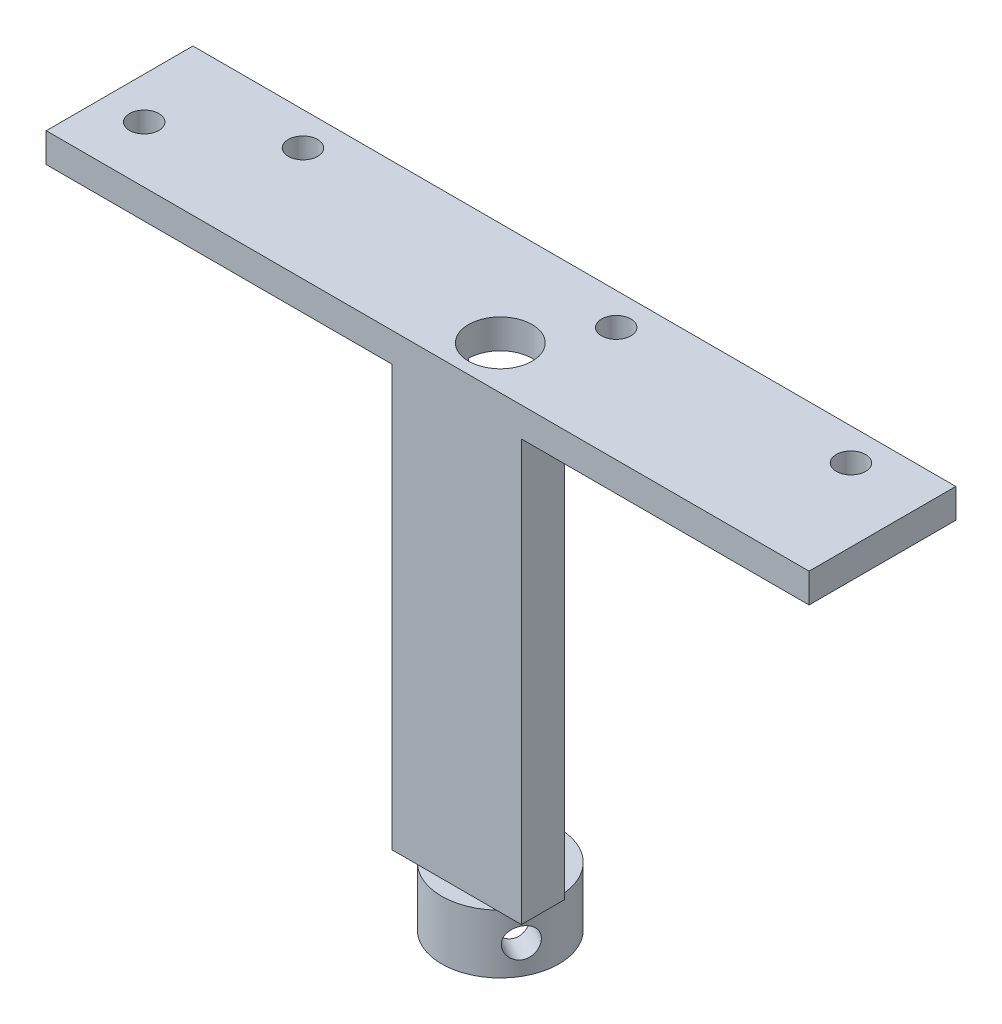
from build123d import *

# Parameters (mm, degrees)
SKETCH_1_W                = 78
SKETCH_1_H                = 15
EXTRUDE_1_DEPTH           = 3
SKETCH_3_R                = 1.5
CUT_EXTRUDE_1_DEPTH       = 3
SKETCH_4_R                = 6
EXTRUDE_2_DEPTH           = 18
SKETCH_5_R                = 4.5
CUT_EXTRUDE_2_DEPTH       = 21
F_2_0MM_2_D               = 3
F_2_0MM_2_DEPTH           = 4.5
F_2_0MM_2_TIP             = 1.5
F_2_0MM_2_ON_FACE_2_D     = 3
F_2_0MM_2_ON_FACE_2_DEPTH = 4.5
F_2_0MM_2_ON_FACE_2_TIP   = 1.5
SKETCH_10_W               = 6
SKETCH_10_H               = 10
CUT_EXTRUDE_3_DEPTH       = 7
SKETCH_13_W               = 19.835687411
SKETCH_13_H               = 21.610205193
CUT_EXTRUDE_4_DEPTH       = 20
SKETCH_14_W               = 11.523038103
SKETCH_14_H               = 10.49031299
EXTRUDE_3_DEPTH           = 3
SKETCH_18_W               = 78
SKETCH_18_H               = 8
EXTRUDE_4_DEPTH           = 3
SKETCH_19_W               = 36.767904102
SKETCH_19_H               = 2.5
EXTRUDE_5_DEPTH           = 12.5
SKETCH_23_R               = 1.65
CUT_EXTRUDE_6_DEPTH       = 12.5
SKETCH_25_W               = 4.236607592
SKETCH_25_H               = 5.36409187
EXTRUDE_7_DEPTH           = 2.5
SKETCH_26_R               = 1.6
CUT_EXTRUDE_7_DEPTH       = 2.5
SKETCH_27_W               = 21.346012392
SKETCH_27_H               = 6.594354882
EXTRUDE_8_DEPTH           = 2.5
SKETCH_28_W               = 36.767231154
SKETCH_28_H               = 5.91819544
EXTRUDE_9_DEPTH           = 2.5
SKETCH_29_W               = 27.660340415
SKETCH_29_H               = 3.5
CUT_EXTRUDE_9_DEPTH       = 2.5
SKETCH_30_W               = 78
SKETCH_30_H               = 8
CUT_EXTRUDE_10_DEPTH      = 100
SKETCH_31_W               = 60.820132647
SKETCH_31_H               = 3
EXTRUDE_10_DEPTH          = 49
SKETCH_32_W               = 48
SKETCH_32_H               = 3.2
CUT_EXTRUDE_11_DEPTH      = 49
SKETCH_33_W               = 15
SKETCH_33_H               = 49.05968874
CUT_EXTRUDE_12_DEPTH      = 100
SKETCH_34_R               = 4.25
EXTRUDE_11_DEPTH          = 49
SKETCH_35_R               = 6
EXTRUDE_12_DEPTH          = 6
SKETCH_36_W               = 8.5
SKETCH_36_H               = 40
CUT_EXTRUDE_13_DEPTH      = 11
SKETCH_37_R               = 3.25
CUT_EXTRUDE_16_DEPTH      = 100
SKETCH_39_W               = 8.456699936
SKETCH_39_H               = 16
CUT_EXTRUDE_17_DEPTH      = 1.25
F_3_0MM_1_D               = 3
F_3_0MM_1_DEPTH           = 4.098709071
F_3_0MM_1_TIP             = 0.901290929
F_3_0MM_2_D               = 3
F_3_0MM_2_DEPTH           = 4.098709071
F_3_0MM_2_TIP             = 0.901290929
F_3_0MM_3_D               = 3
F_3_0MM_3_DEPTH           = 4.098709071
F_3_0MM_3_TIP             = 0.901290929
SKETCH_46_W               = 13.227107738
SKETCH_46_H               = 4.428434999
EXTRUDE_13_DEPTH          = 46
CUT_EXTRUDE_18_DEPTH      = 55


with BuildPart() as part:
    # 草图1 → 凸台-拉伸1 (new body)
    with BuildSketch(Plane(origin=(0, 0, 0), x_dir=(1, 0, 0), z_dir=(0, 1, 0))):
        Rectangle(SKETCH_1_W, SKETCH_1_H)
    extrude(amount=EXTRUDE_1_DEPTH)

    # 草图3 → 切除-拉伸1 (cut)
    with BuildSketch(Plane(origin=(0, 3, 0), x_dir=(1, 0, 0), z_dir=(0, 1, 0))):
        with Locations((-34.76, -1.72)):
            Circle(SKETCH_3_R)
        with Locations((-24.35, 4.1)):
            Circle(SKETCH_3_R)
        with Locations((31.56, 4.221692081)):
            Circle(SKETCH_3_R)
        with Locations((7.56, 4.221692081)):
            Circle(SKETCH_3_R)
    extrude(amount=-CUT_EXTRUDE_1_DEPTH, mode=Mode.SUBTRACT)

    # 草图4 → 凸台-拉伸2 (add)
    with BuildSketch(Plane(origin=(0, 3, 0), x_dir=(1, 0, 0), z_dir=(0, 1, 0))):
        with Locations((-3, -1.234165229)):
            Circle(SKETCH_4_R)
    extrude(amount=EXTRUDE_2_DEPTH)

    # 草图5 → 切除-拉伸2 (cut)
    with BuildSketch(Plane(origin=(0, 21, 0), x_dir=(1, 0, 0), z_dir=(0, 1, 0))):
        with Locations((-3, -1.234165229)):
            Circle(SKETCH_5_R)
    extrude(amount=-CUT_EXTRUDE_2_DEPTH, mode=Mode.SUBTRACT)

    # Ø2.0mm 暗销孔2
    with Locations(Plane(origin=(-7.901331048, 17.342107422, 4.694938836), x_dir=(-0.576795601176, 0, -0.816888507977), z_dir=(-0.816888507977, 0, 0.576795601176))):
        with Locations((0, 0)):
            Hole(F_2_0MM_2_D / 2, depth=F_2_0MM_2_DEPTH)
            with Locations((0, 0, -(F_2_0MM_2_DEPTH + F_2_0MM_2_TIP / 2))):  # 90° drill point
                Cone(0, F_2_0MM_2_D / 2, F_2_0MM_2_TIP, mode=Mode.SUBTRACT)

    # Ø2.0mm 暗销孔2 on face 2
    with Locations(Plane(origin=(1.071764877, 17.164817099, 5.641061052), x_dir=(0.734483043181, 0, -0.678627039897), z_dir=(0.678627039897, 0, 0.734483043181))):
        with Locations((0, 0)):
            Hole(F_2_0MM_2_ON_FACE_2_D / 2, depth=F_2_0MM_2_ON_FACE_2_DEPTH)
            with Locations((0, 0, -(F_2_0MM_2_ON_FACE_2_DEPTH + F_2_0MM_2_ON_FACE_2_TIP / 2))):  # 90° drill point
                Cone(0, F_2_0MM_2_ON_FACE_2_D / 2, F_2_0MM_2_ON_FACE_2_TIP, mode=Mode.SUBTRACT)

    # 草图10 → 切除-拉伸3 (cut)
    with BuildSketch(Plane(origin=(0, 0, -7.5), x_dir=(-1, 0, 0), z_dir=(0, 0, -1))):
        with Locations((3, 8)):
            Rectangle(SKETCH_10_W, SKETCH_10_H)
    extrude(amount=-CUT_EXTRUDE_3_DEPTH, mode=Mode.SUBTRACT)

    # 草图13 → 切除-拉伸4 (cut)
    with BuildSketch(Plane(origin=(0, 0, -7.5), x_dir=(-1, 0, 0), z_dir=(0, 0, -1))):
        with Locations((3.314421038, 13.805102597)):
            Rectangle(SKETCH_13_W, SKETCH_13_H)
    extrude(amount=-CUT_EXTRUDE_4_DEPTH, mode=Mode.SUBTRACT)

    # 草图14 → 凸台-拉伸3 (add)
    with BuildSketch(Plane(origin=(0, 3, 0), x_dir=(1, 0, 0), z_dir=(0, 1, 0))):
        with Locations((-2.989467433, -1.263493391)):
            Rectangle(SKETCH_14_W, SKETCH_14_H)
    extrude(amount=-EXTRUDE_3_DEPTH)

    # 草图18 → 凸台-拉伸4 (add)
    with BuildSketch(Plane.XZ):
        with Locations((0, 11.5)):
            Rectangle(SKETCH_18_W, SKETCH_18_H)
    extrude(amount=-EXTRUDE_4_DEPTH)

    # 草图19 → 凸台-拉伸5 (add)
    with BuildSketch(Plane.XZ):
        with Locations((0.839237194, 14.25)):
            Rectangle(SKETCH_19_W, SKETCH_19_H)
    extrude(amount=EXTRUDE_5_DEPTH)

    # 草图23 → 切除-拉伸6 (cut)
    with BuildSketch(Plane(origin=(0, 0, 13), x_dir=(-1, 0, 0), z_dir=(0, 0, -1))):
        with Locations((-8.603189245, -6.05592298)):
            Circle(SKETCH_23_R)
        with Locations((2.596810755, -6.05592298)):
            Circle(SKETCH_23_R)
    extrude(amount=-CUT_EXTRUDE_6_DEPTH, mode=Mode.SUBTRACT)

    # 草图25 → 凸台-拉伸7 (add)
    with BuildSketch(Plane(origin=(0, 0, 13), x_dir=(-1, 0, 0), z_dir=(0, 0, -1))):
        with Locations((2.330668631, -6.426480946)):
            Rectangle(SKETCH_25_W, SKETCH_25_H)
    extrude(amount=-EXTRUDE_7_DEPTH)

    # 草图26 → 切除-拉伸7 (cut)
    with BuildSketch(Plane(origin=(0, 0, 13), x_dir=(-1, 0, 0), z_dir=(0, 0, -1))):
        with Locations((4.196810755, -6.05592298)):
            Circle(SKETCH_26_R)
    extrude(amount=-CUT_EXTRUDE_7_DEPTH, mode=Mode.SUBTRACT)

    # 草图27 → 凸台-拉伸8 (add)
    with BuildSketch(Plane(origin=(0, 0, 13), x_dir=(-1, 0, 0), z_dir=(0, 0, -1))):
        with Locations((-2.379316694, -6.691741876)):
            Rectangle(SKETCH_27_W, SKETCH_27_H)
    extrude(amount=-EXTRUDE_8_DEPTH)

    # 草图28 → 凸台-拉伸9 (add)
    with BuildSketch(Plane(origin=(0, 0, 13), x_dir=(-1, 0, 0), z_dir=(0, 0, -1))):
        with Locations((-0.839573668, -15.45909772)):
            Rectangle(SKETCH_28_W, SKETCH_28_H)
    extrude(amount=-EXTRUDE_9_DEPTH)

    # 草图29 → 切除-拉伸9 (cut)
    with BuildSketch(Plane(origin=(0, 0, 13), x_dir=(-1, 0, 0), z_dir=(0, 0, -1))):
        with Locations((-0.633763758, -13.394190827)):
            Rectangle(SKETCH_29_W, SKETCH_29_H)
    extrude(amount=-CUT_EXTRUDE_9_DEPTH, mode=Mode.SUBTRACT)

    # 草图30 → 切除-拉伸10 (cut)
    with BuildSketch(Plane(origin=(0, 3, 0), x_dir=(1, 0, 0), z_dir=(0, 1, 0))):
        with Locations((0, -11.5)):
            Rectangle(SKETCH_30_W, SKETCH_30_H)
    extrude(amount=-CUT_EXTRUDE_10_DEPTH, mode=Mode.SUBTRACT)

    # 草图31 → 凸台-拉伸10 (add)
    with BuildSketch(Plane.XZ):
        with Locations((0.65611444, 6)):
            Rectangle(SKETCH_31_W, SKETCH_31_H)
    extrude(amount=EXTRUDE_10_DEPTH)

    # 草图32 → 切除-拉伸11 (cut)
    with BuildSketch(Plane(origin=(0, 0, 4.5), x_dir=(-1, 0, 0), z_dir=(0, 0, -1))):
        with Locations((-0.15338956, -37.454114518)):
            Rectangle(SKETCH_32_W, SKETCH_32_H)
        with Locations((-0.189333293, -44.654114518)):
            Rectangle(SKETCH_32_W, SKETCH_32_H)
        with Locations((-0.173277927, -30.254114518)):
            Rectangle(SKETCH_32_W, SKETCH_32_H)
        with Locations((-0.205191163, -23.054114518)):
            Rectangle(SKETCH_32_W, SKETCH_32_H)
        with Locations((-0.175604554, -15.854114518)):
            Rectangle(SKETCH_32_W, SKETCH_32_H)
        with Locations((-0.276259634, -9.654114518)):
            Rectangle(SKETCH_32_W, SKETCH_32_H)
    extrude(amount=-CUT_EXTRUDE_11_DEPTH, mode=Mode.SUBTRACT)

    # 草图33 → 切除-拉伸12 (cut)
    with BuildSketch(Plane(origin=(31.066180764, 0, 0), x_dir=(0, 0, -1), z_dir=(1, 0, 0))):
        with Locations((0, -24.52984437)):
            Rectangle(SKETCH_33_W, SKETCH_33_H)
    extrude(amount=-CUT_EXTRUDE_12_DEPTH, mode=Mode.SUBTRACT)

    # 草图34 → 凸台-拉伸11 (add)
    with BuildSketch(Plane.XZ):
        with Locations((3, 3.071565001)):
            Circle(SKETCH_34_R)
    extrude(amount=EXTRUDE_11_DEPTH)

    # 草图35 → 凸台-拉伸12 (add)
    with BuildSketch(Plane.XZ.offset(49)):
        with Locations((3, 3.071565001)):
            Circle(SKETCH_35_R)
    extrude(amount=-EXTRUDE_12_DEPTH)

    # 草图36 → 切除-拉伸13 (cut)
    with BuildSketch(Plane(origin=(0, 0, -7.5), x_dir=(-1, 0, 0), z_dir=(0, 0, -1))):
        with Locations((-3, -20)):
            Rectangle(SKETCH_36_W, SKETCH_36_H)
    extrude(amount=-CUT_EXTRUDE_13_DEPTH, mode=Mode.SUBTRACT)

    # 草图37 → 切除-拉伸16 (cut)
    with BuildSketch(Plane.XZ.offset(49)):
        with Locations((3, 3.071565001)):
            Circle(SKETCH_37_R)
    extrude(amount=-CUT_EXTRUDE_16_DEPTH, mode=Mode.SUBTRACT)

    # 草图39 → 切除-拉伸17 (cut)
    with BuildSketch(Plane(origin=(0, 0, 3.5), x_dir=(-1, 0, 0), z_dir=(0, 0, -1))):
        with Locations((-3, -32)):
            Rectangle(SKETCH_39_W, SKETCH_39_H)
    extrude(amount=-CUT_EXTRUDE_17_DEPTH, mode=Mode.SUBTRACT)

    # Ø3.0mm 暗销孔1
    with Locations(Plane(origin=(3.06916604, -45.926554475, -2.928036324), x_dir=(-0.999933554166, 0, -0.011527673319), z_dir=(0.011527673319, 0, -0.999933554166))):
        with Locations((0, 0)):
            Hole(F_3_0MM_1_D / 2, depth=F_3_0MM_1_DEPTH)
            with Locations((0, 0, -(F_3_0MM_1_DEPTH + F_3_0MM_1_TIP / 2))):  # 118° drill point
                Cone(0, F_3_0MM_1_D / 2, F_3_0MM_1_TIP, mode=Mode.SUBTRACT)

    # Ø3.0mm 暗销孔2
    with Locations(Plane(origin=(-2.19436254, -45.980907568, 6.074663036), x_dir=(-0.500516339146, 0, -0.865727089936), z_dir=(-0.865727089936, 0, 0.500516339146))):
        with Locations((0, 0)):
            Hole(F_3_0MM_2_D / 2, depth=F_3_0MM_2_DEPTH)
            with Locations((0, 0, -(F_3_0MM_2_DEPTH + F_3_0MM_2_TIP / 2))):  # 118° drill point
                Cone(0, F_3_0MM_2_D / 2, F_3_0MM_2_TIP, mode=Mode.SUBTRACT)

    # Ø3.0mm 暗销孔3
    with Locations(Plane(origin=(8.205806468, -46.039954185, 6.054781221), x_dir=(-0.497202703373, 0, 0.86763441135), z_dir=(0.86763441135, 0, 0.497202703373))):
        with Locations((0, 0)):
            Hole(F_3_0MM_3_D / 2, depth=F_3_0MM_3_DEPTH)
            with Locations((0, 0, -(F_3_0MM_3_DEPTH + F_3_0MM_3_TIP / 2))):  # 118° drill point
                Cone(0, F_3_0MM_3_D / 2, F_3_0MM_3_TIP, mode=Mode.SUBTRACT)

    # 草图46 → 凸台-拉伸13 (add)
    with BuildSketch(Plane(origin=(0, 3, 0), x_dir=(1, 0, 0), z_dir=(0, 1, 0))):
        with Locations((2.976074231, -5.285782501)):
            Rectangle(SKETCH_46_W, SKETCH_46_H)
    extrude(amount=-EXTRUDE_13_DEPTH)

    # 草图48 → 切除-拉伸18 (cut)
    with BuildSketch(Plane.XZ.offset(49)):
        with BuildLine():
            Line((-0.25, 3.071565001), (6.25, 3.071565001))
            ThreePointArc((6.25, 3.071565001), (3, 6.321565001), (-0.25, 3.071565001))
        make_face()
    extrude(amount=-CUT_EXTRUDE_18_DEPTH, mode=Mode.SUBTRACT)


solid = part.part
